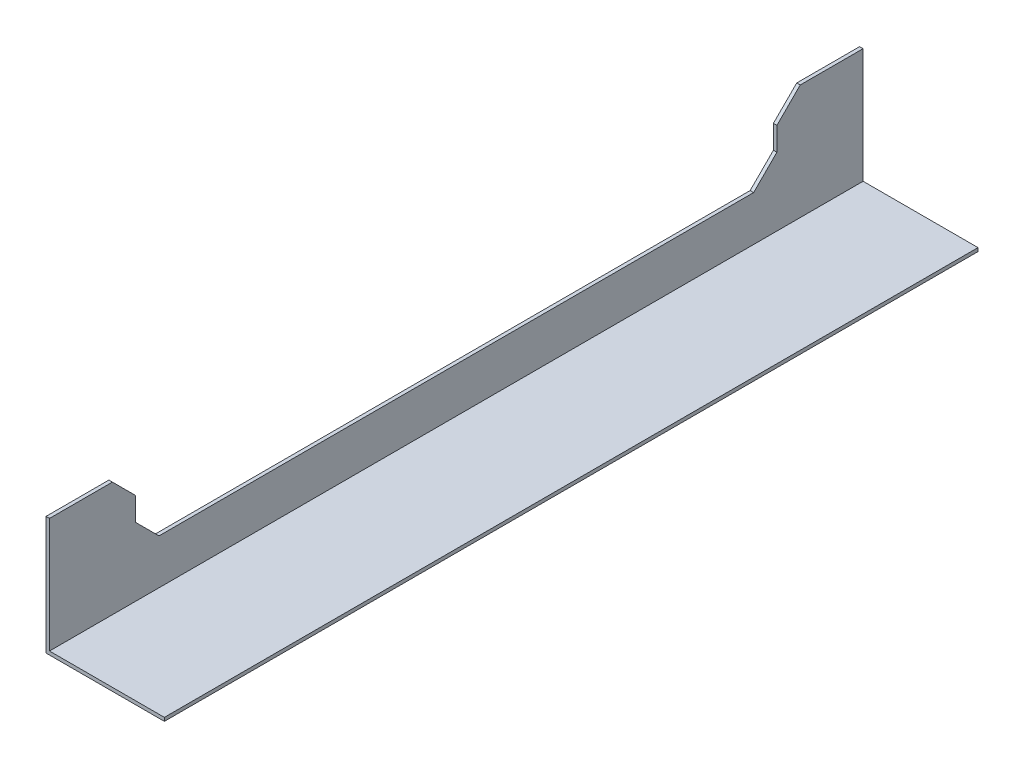
from build123d import *

# Parameters (mm, degrees)
SALIENTE_EXTRUIR1_DEPTH    = 349.2
CORTAR_EXTRUIR2_DEPTH      = 357.513562154
CORTAR_EXTRUIR2_DEPTH_BACK = 2
CHAFL_N1_SIZE              = 10


with BuildPart() as part:
    # Croquis1 → Saliente-Extruir1 (new body)
    with BuildSketch(Plane.XY):
        Polygon((0, 0), (0, 50.8), (1.5, 50.8), (1.5, 1.5), (50.8, 1.5), (50.8, 0), align=None)
    extrude(amount=SALIENTE_EXTRUIR1_DEPTH)

    # Croquis5 → Cortar-Extruir2 (cut, two sides: drawn at the far end of the back side and taken through both)
    with BuildSketch(Plane.ZY.offset(-CORTAR_EXTRUIR2_DEPTH_BACK)):
        Polygon((312.2, 693.411982182), (312.2, 50.8), (312.2, 20.8), (37, 20.8), (37, 50.8), (37, 693.411982182), (37, 1978.635946545), (312.2, 1978.635946545), align=None)
    extrude(amount=CORTAR_EXTRUIR2_DEPTH + CORTAR_EXTRUIR2_DEPTH_BACK, mode=Mode.SUBTRACT)

    # Chaflán1
    chafl_n1_edges = [part.edges().sort_by_distance(p)[0] for p in [
        (0.75, 50.8, 37),
        (0.75, 20.8, 37),
        (0.75, 20.8, 312.2),
        (0.75, 50.8, 312.2),
    ]]
    chamfer(chafl_n1_edges, length=CHAFL_N1_SIZE)


solid = part.part
